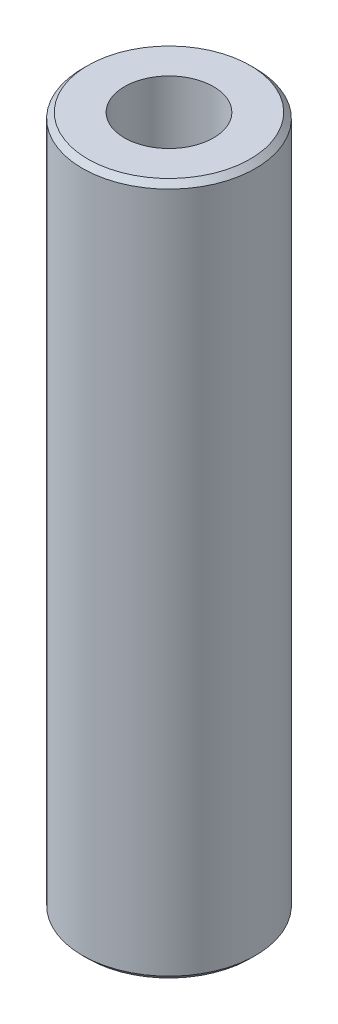
from build123d import *

# Parameters (mm, degrees)
CROQUIS2_R                = 6.35
SALIENTE_EXTRUIR1_DEPTH   = 25.4
CHAFL_N1_SIZE             = 0.396875
CLEARANCE_HOLE_DEPTH      = 27.940768363
CLEARANCE_HOLE_DEPTH_BACK = 27.940768363
CROQUIS4_R                = 3.2639


with BuildPart() as part:
    # Croquis2 → Saliente-Extruir1 (new, symmetric)
    with BuildSketch(Plane(origin=(0, 0, 0), x_dir=(1, 0, 0), z_dir=(0, 1, 0))):
        Circle(CROQUIS2_R)
    extrude(amount=SALIENTE_EXTRUIR1_DEPTH, both=True)

    # Chaflán1
    chafl_n1_edges = [part.edges().sort_by_distance(p)[0] for p in [
        (-6.35, -25.4, 0),
        (-6.35, 25.4, 0),
    ]]
    chamfer(chafl_n1_edges, length=CHAFL_N1_SIZE)

    # Croquis4 → Clearance Hole (cut, two sides: drawn at the far end of the back side and taken through both)
    with BuildSketch(Plane(origin=(0, 0, 0), x_dir=(1, 0, 0), z_dir=(0, 1, 0)).offset(-CLEARANCE_HOLE_DEPTH_BACK)):
        Circle(CROQUIS4_R)
    extrude(amount=CLEARANCE_HOLE_DEPTH + CLEARANCE_HOLE_DEPTH_BACK, mode=Mode.SUBTRACT)


solid = part.part
